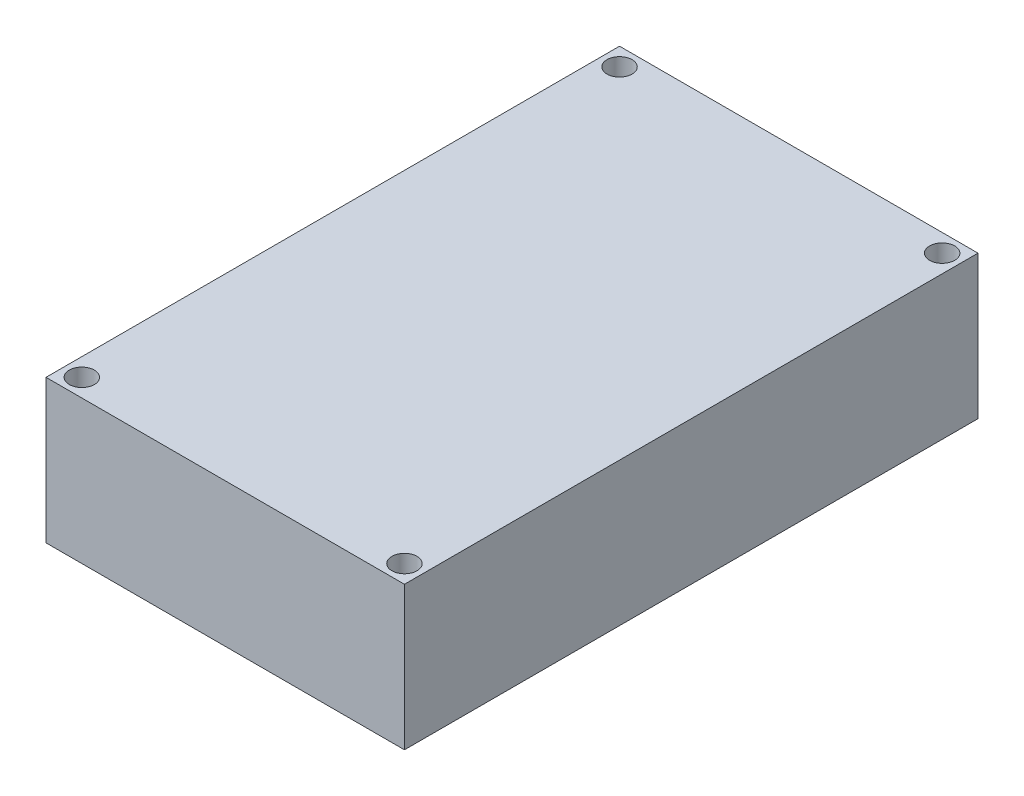
from build123d import *

# Parameters (mm, degrees)
SKETCH1_W           = 50
SKETCH1_H           = 80
SKETCH1_R           = 1.75
BOSS_EXTRUDE1_DEPTH = 20


with BuildPart() as part:
    # Sketch1 → Boss-Extrude1 (new body)
    with BuildSketch(Plane(origin=(0, 0, 0), x_dir=(1, 0, 0), z_dir=(0, 1, 0))):
        with Locations((18.440633245, -17.103166227)):
            Rectangle(SKETCH1_W, SKETCH1_H)
        with Locations((40.940633245, 20.396833773)):
            Circle(SKETCH1_R, mode=Mode.SUBTRACT)
        with Locations((-4.059366755, 20.396833773)):
            Circle(SKETCH1_R, mode=Mode.SUBTRACT)
        with Locations((-4.059366755, -54.603166227)):
            Circle(SKETCH1_R, mode=Mode.SUBTRACT)
        with Locations((40.940633245, -54.603166227)):
            Circle(SKETCH1_R, mode=Mode.SUBTRACT)
    extrude(amount=BOSS_EXTRUDE1_DEPTH)


solid = part.part
